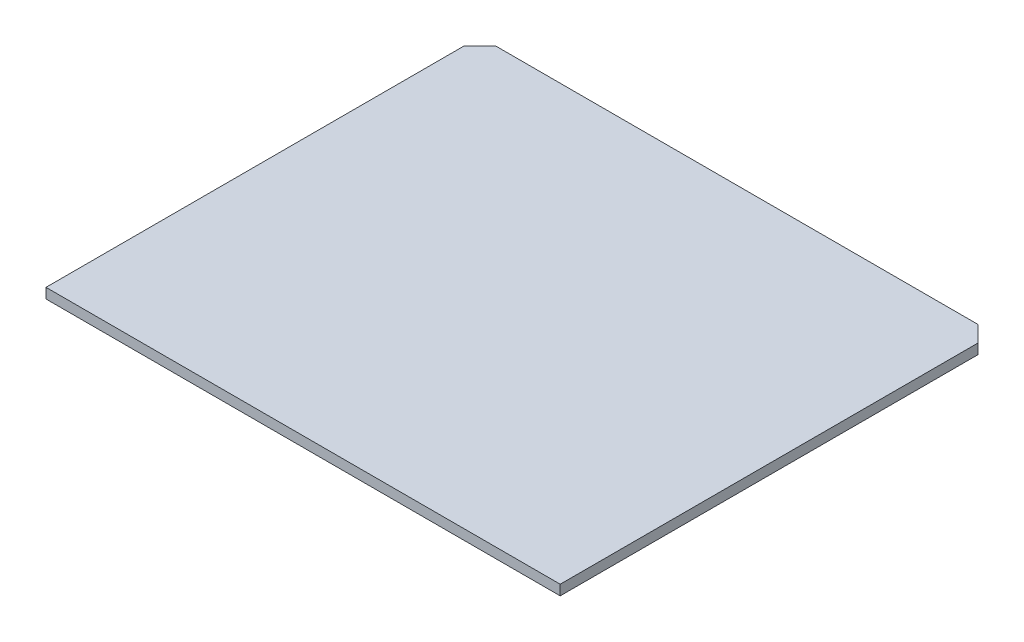
from build123d import *

# Parameters (mm, degrees)
SKETCH1_W           = 81.28
SKETCH1_H           = 68.58
BOSS_EXTRUDE1_DEPTH = 1.6
CHAMFER1_SIZE       = 2.54


with BuildPart() as part:
    # Sketch1 → Boss-Extrude1 (new body)
    with BuildSketch(Plane(origin=(0, 0, 0), x_dir=(1, 0, 0), z_dir=(0, 1, 0))):
        Rectangle(SKETCH1_W, SKETCH1_H)
    extrude(amount=BOSS_EXTRUDE1_DEPTH)

    # Chamfer1
    chamfer1_edges = [part.edges().sort_by_distance(p)[0] for p in [
        (40.64, 0.8, -34.29),
        (-40.64, 0.8, -34.29),
    ]]
    chamfer(chamfer1_edges, length=CHAMFER1_SIZE)


solid = part.part
